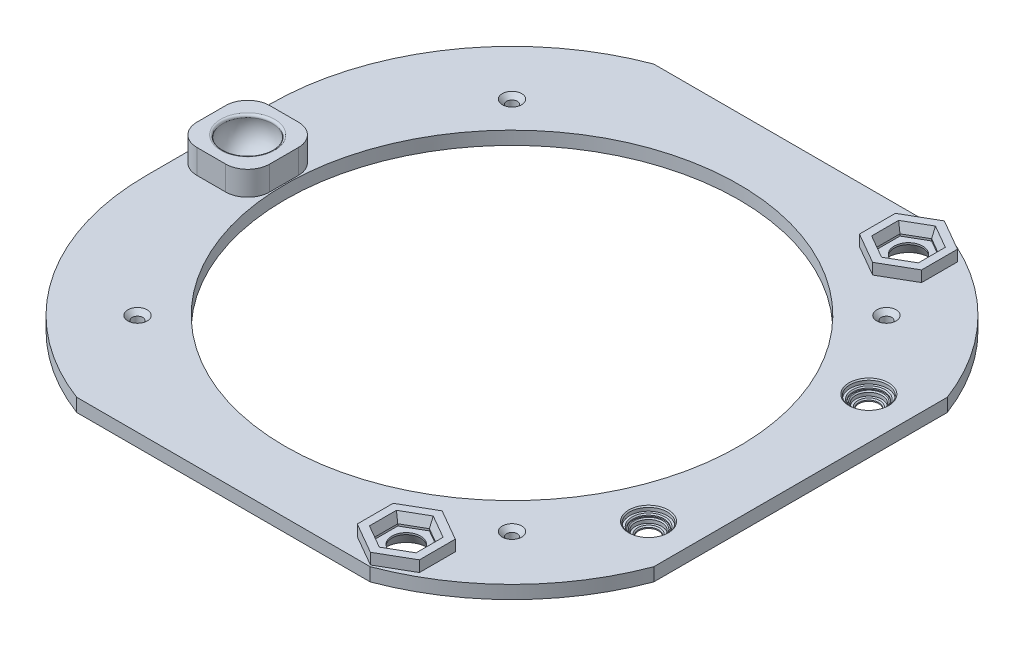
from build123d import *
from OCP.BRepFilletAPI import BRepFilletAPI_MakeChamfer

# Parameters (mm, degrees)
SKETCH_1_W           = 276
SKETCH_1_H           = 276
EXTRUDE_1_DEPTH      = 6
SKETCH_4_R           = 6.5
SKETCH_4_R_2         = 2
CUT_EXTRUDE_1_DEPTH  = 10
SKETCH_5_R           = 2.4
CUT_EXTRUDE_2_DEPTH  = 196.253681143
FILLET_1_R           = 110
EXTRUDE_1_2_DEPTH    = 5
CHAMFER_2_SIZE       = 1.5
CHAMFER_2_SIZE2      = 4.121216129
SKETCH_9_W           = 33
SKETCH_9_H           = 33
EXTRUDE_2_DEPTH      = 11
FILLET_2_R           = 1
FILLET_3_R           = 10
CHAMFER_5_SIZE       = 3
CHAMFER_5_SIZE2      = 5.196152423
SKETCH_6_R           = 103
CUT_EXTRUDE_3_DEPTH  = 10
CHAMFER_6_SIZE       = 2
SKETCH_13_R          = 4.5
CUT_EXTRUDE_6_DEPTH  = 196.47122551
SKETCH_14_R          = 6
CUT_EXTRUDE_7_DEPTH  = 5
SKETCH_15_R          = 7
CUT_EXTRUDE_8_DEPTH  = 3
SKETCH_16_R          = 8.5
CUT_EXTRUDE_9_DEPTH  = 2
CHAMFER_7_SIZE       = 0.5
SKETCH_18_W          = 167.450202049
SKETCH_18_H          = 12.846548741
SKETCH_18_W_2        = 47.896370642
SKETCH_18_H_2        = 198.133814491
CUT_EXTRUDE_10_DEPTH = 196.900484949


# Read off the part's stored shape, not the designer's step: Вытянуть-Тонкостенный1
with BuildPart() as part:
    # Эскиз1 → Extrude 1 (new body)
    with BuildSketch(Plane(origin=(0, 0, 0), x_dir=(1, 0, 0), z_dir=(0, 1, 0))):
        Rectangle(SKETCH_1_W, SKETCH_1_H)
    extrude(amount=EXTRUDE_1_DEPTH)

    # Эскиз4 → Cut-Extrude 1 (cut)
    with BuildSketch(Plane(origin=(0, 6, 0), x_dir=(1, 0, 0), z_dir=(0, 1, 0))):
        with Locations(Location((66, 114, 0), (0, 0, 270))):
            Circle(SKETCH_4_R)
        with Locations(Location((-120, 0, 0), (0, 0, 270))):
            Circle(SKETCH_4_R_2)
        with Locations(Location((66, -114, 0), (0, 0, 90))):
            Circle(SKETCH_4_R)
    extrude(amount=-CUT_EXTRUDE_1_DEPTH, mode=Mode.SUBTRACT)

    # Эскиз5 → Вырез-Вытянуть2 (cut, through all)
    with BuildSketch(Plane(origin=(0, 6, 0), x_dir=(1, 0, 0), z_dir=(0, 1, 0))):
        with Locations(Location((-85, 85, 0), (0, 0, 270))):
            Circle(SKETCH_5_R)
        with Locations(Location((85, 85, 0), (0, 0, 270))):
            Circle(SKETCH_5_R)
        with Locations(Location((85, -85, 0), (0, 0, 270))):
            Circle(SKETCH_5_R)
        with Locations(Location((-85, -85, 0), (0, 0, 270))):
            Circle(SKETCH_5_R)
        with Locations(Location((-90, 0, 0), (0, 0, 270))):
            Circle(SKETCH_5_R)
        with Locations(Location((0, 90, 0), (0, 0, 270))):
            Circle(SKETCH_5_R)
        with Locations(Location((0, -90, 0), (0, 0, 90))):
            Circle(SKETCH_5_R)
        with Locations(Location((90, 0, 0), (0, 0, 90))):
            Circle(SKETCH_5_R)
    extrude(amount=-CUT_EXTRUDE_2_DEPTH, mode=Mode.SUBTRACT)

    # Скругление1
    fillet_1_edges = [part.edges().sort_by_distance(p)[0] for p in [
        (138, 3, 138),
        (-138, 3, 138),
        (-138, 3, -138),
        (138, 3, -138),
    ]]
    fillet(fillet_1_edges, radius=FILLET_1_R)

    # Extrude 1 2 outline → Extrude 1 2 (add)
    # profile 1 of 2: a face of its own
    with BuildSketch(Plane(origin=(0, 6, 0), x_dir=(1, 0, 0), z_dir=(0, 1, 0))):
        Polygon((80.1, -105.859361204), (66, -97.718722409), (51.9, -105.859361204), (51.9, -122.140638796), (66, -130.281277591), (80.1, -122.140638796), align=None)
        Polygon((56.9, -108.74611255), (66, -103.492225101), (75.1, -108.74611255), (75.1, -119.25388745), (66, -124.507774899), (56.9, -119.25388745), align=None, mode=Mode.SUBTRACT)
    # profile 2 of 2: a face of its own
    with BuildSketch(Plane(origin=(0, 6, 0), x_dir=(1, 0, 0), z_dir=(0, 1, 0))):
        Polygon((51.9, 122.140638796), (51.9, 105.859361204), (66, 97.718722409), (80.1, 105.859361204), (80.1, 122.140638796), (66, 130.281277591), align=None)
        Polygon((66, 103.492225101), (56.9, 108.74611255), (56.9, 119.25388745), (66, 124.507774899), (75.1, 119.25388745), (75.1, 108.74611255), align=None, mode=Mode.SUBTRACT)
    extrude(amount=EXTRUDE_1_2_DEPTH)

    # Фаска2: one chamfer whose edges measure the first distance from different faces: ONE call of the kernel's chamfer builder (chamfer() names one face for all edges)
    chamfer_2_edges_1 = [part.edges().sort_by_distance(p)[0] for p in [
        (70.55, 11, 106.119168825),
        (61.45, 11, 106.119168825),
        (56.9, 11, 114),
        (61.45, 11, 121.880831175),
        (70.55, 11, 121.880831175),
        (75.1, 11, 114),
    ]]
    chamfer_2_side_1 = [part.faces().sort_by_distance(p)[0] for p in [
        (72.834618942, 11, 102.162092741),
    ]]
    chamfer_2_edges_2 = [part.edges().sort_by_distance(p)[0] for p in [
        (75.1, 11, -114),
        (70.55, 11, -121.880831175),
        (61.45, 11, -121.880831175),
        (56.9, 11, -114),
        (61.45, 11, -106.119168825),
        (70.55, 11, -106.119168825),
    ]]
    chamfer_2_side_2 = [part.faces().sort_by_distance(p)[0] for p in [
        (52.330762115, 11, -114),
    ]]
    chamfer_2 = BRepFilletAPI_MakeChamfer(part.part.solid().wrapped)
    for e in chamfer_2_edges_1:
        chamfer_2.Add(CHAMFER_2_SIZE, CHAMFER_2_SIZE2, e.wrapped, chamfer_2_side_1[0].wrapped)  # the first distance lies on this face
    for e in chamfer_2_edges_2:
        chamfer_2.Add(CHAMFER_2_SIZE, CHAMFER_2_SIZE2, e.wrapped, chamfer_2_side_2[0].wrapped)  # the first distance lies on this face
    add(Compound.cast(chamfer_2.Shape()), mode=Mode.REPLACE)

    # Эскиз9 → Бобышка-Вытянуть2 (add)
    with BuildSketch(Plane(origin=(0, 6, 0), x_dir=(1, 0, 0), z_dir=(0, 1, 0))):
        with Locations((-120, 0)):
            Rectangle(SKETCH_9_W, SKETCH_9_H)
    extrude(amount=EXTRUDE_2_DEPTH)

    # Эскиз10 → Вырез-Повернуть1 (revolve, cut)
    with BuildSketch(Plane(origin=(0, 13, 0), x_dir=(1, 0, 0), z_dir=(0, 1, 0))):
        with BuildLine():
            Line((-131.6, 0), (-108.4, 0))
            ThreePointArc((-108.4, 0), (-120, 11.6), (-131.6, 0))
        make_face()
    revolve(axis=Axis((-131.6, 13, 0), (1, 0, 0)), mode=Mode.SUBTRACT)

    # Скругление2
    fillet_2_edges = [part.edges().sort_by_distance(p)[0] for p in [
        (-119.999999999, 1.573714514, -1.999999986),
        (-120, 17, -10.888526071),
    ]]
    fillet(fillet_2_edges, radius=FILLET_2_R)

    # Скругление3
    fillet_3_edges = [part.edges().sort_by_distance(p)[0] for p in [
        (-103.5, 11.5, 16.5),
        (-103.5, 11.5, -16.5),
        (-136.5, 11.5, -16.5),
        (-136.5, 11.5, 16.5),
    ]]
    fillet(fillet_3_edges, radius=FILLET_3_R)

    # Фаска5
    chamfer_5_edges = [part.edges().sort_by_distance(p)[0] for p in [
        (66, 0, 120.5),
        (66, 0, -120.5),
    ]]
    chamfer_5_side = [part.faces().sort_by_distance(p)[0] for p in [
        (-0.244968045, 0, 0),
    ]]
    chamfer(chamfer_5_edges, length=CHAMFER_5_SIZE, length2=CHAMFER_5_SIZE2, reference=chamfer_5_side[0])

    # Эскиз6 → Вырез-Вытянуть3 (cut)
    with BuildSketch(Plane(origin=(0, 6, 0), x_dir=(1, 0, 0), z_dir=(0, 1, 0))):
        with Locations(Location((0, 0, 0), (0, 0, 270))):
            Circle(SKETCH_6_R)
    extrude(amount=-CUT_EXTRUDE_3_DEPTH, mode=Mode.SUBTRACT)

    # Фаска6
    chamfer_6_edges = [part.edges().sort_by_distance(p)[0] for p in [
        (85, 6, -87.4),
        (85, 6, 82.6),
        (-85, 6, 82.6),
        (-85, 6, -87.4),
    ]]
    chamfer(chamfer_6_edges, length=CHAMFER_6_SIZE)

    # Эскиз13 → Вырез-Вытянуть6 (cut, through all)
    with BuildSketch(Plane(origin=(0, 6, 0), x_dir=(1, 0, 0), z_dir=(0, 1, 0))):
        with Locations(Location((112, 50, 0), (0, 0, 270))):
            Circle(SKETCH_13_R)
        with Locations(Location((112, -50, 0), (0, 0, 90))):
            Circle(SKETCH_13_R)
    extrude(amount=-CUT_EXTRUDE_6_DEPTH, mode=Mode.SUBTRACT)

    # Эскиз14 → Вырез-Вытянуть7 (cut)
    with BuildSketch(Plane(origin=(0, 6, 0), x_dir=(1, 0, 0), z_dir=(0, 1, 0))):
        with Locations(Location((112, 50, 0), (0, 0, 270))):
            Circle(SKETCH_14_R)
        with Locations(Location((112, -50, 0), (0, 0, 90))):
            Circle(SKETCH_14_R)
    extrude(amount=-CUT_EXTRUDE_7_DEPTH, mode=Mode.SUBTRACT)

    # Эскиз15 → Вырез-Вытянуть8 (cut)
    with BuildSketch(Plane(origin=(0, 6, 0), x_dir=(1, 0, 0), z_dir=(0, 1, 0))):
        with Locations(Location((112, 50, 0), (0, 0, 270))):
            Circle(SKETCH_15_R)
        with Locations(Location((112, -50, 0), (0, 0, 90))):
            Circle(SKETCH_15_R)
    extrude(amount=-CUT_EXTRUDE_8_DEPTH, mode=Mode.SUBTRACT)

    # Эскиз16 → Вырез-Вытянуть9 (cut)
    with BuildSketch(Plane(origin=(0, 6, 0), x_dir=(1, 0, 0), z_dir=(0, 1, 0))):
        with Locations(Location((112, 50, 0), (0, 0, 270))):
            Circle(SKETCH_16_R)
        with Locations(Location((112, -50, 0), (0, 0, 90))):
            Circle(SKETCH_16_R)
    extrude(amount=-CUT_EXTRUDE_9_DEPTH, mode=Mode.SUBTRACT)

    # Фаска7
    chamfer_7_edges = [part.edges().sort_by_distance(p)[0] for p in [
        (112, 1, -54.5),
        (112, 1, 54.5),
        (112, 3, -56),
        (112, 3, 56),
        (112, 6, -58.5),
        (112, 4, -57),
        (112, 4, 57),
        (112, 6, 58.5),
    ]]
    chamfer(chamfer_7_edges, length=CHAMFER_7_SIZE)

    # Эскиз18 → Вырез-Вытянуть10 (cut, through all)
    with BuildSketch(Plane(origin=(0, 17, 0), x_dir=(1, 0, 0), z_dir=(0, 1, 0))):
        with Locations((-6.548331924, 137.42327437)):
            Rectangle(SKETCH_18_W, SKETCH_18_H)
        with Locations((-6.548331924, -137.42327437)):
            Rectangle(SKETCH_18_W, SKETCH_18_H)
        with Locations((154.948185321, -9.822497885)):
            Rectangle(SKETCH_18_W_2, SKETCH_18_H_2)
    extrude(amount=-CUT_EXTRUDE_10_DEPTH, mode=Mode.SUBTRACT)


solid = part.part
